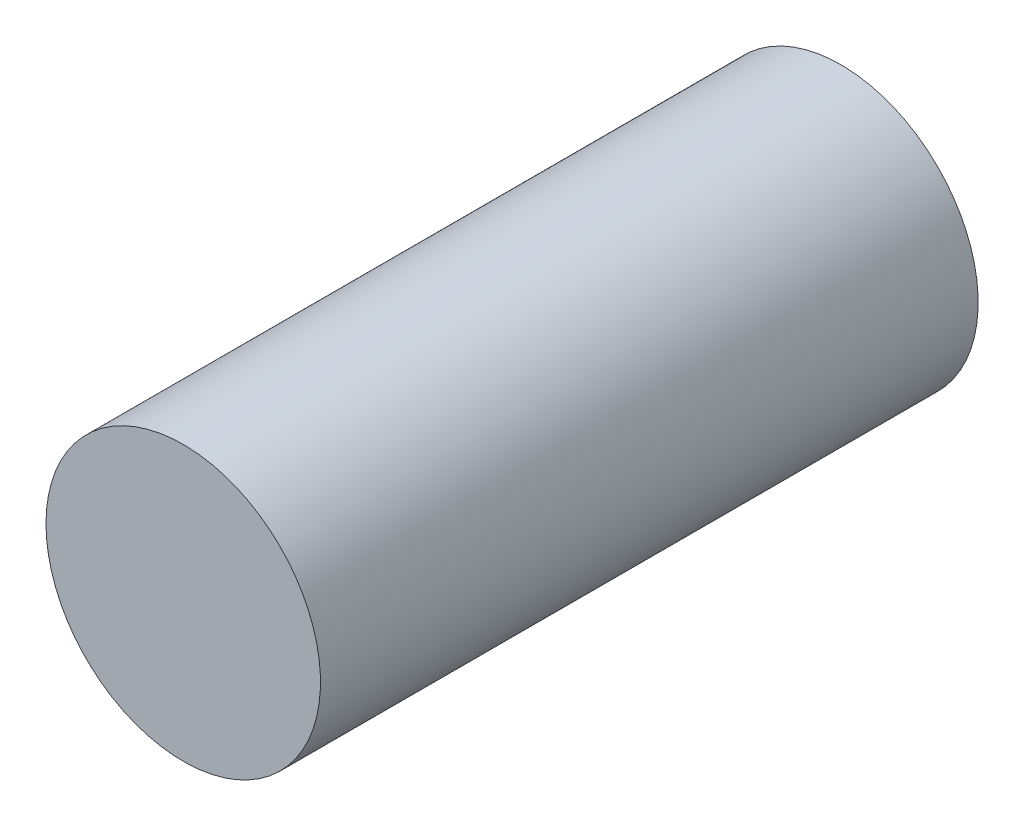
from build123d import *

# Parameters (mm, degrees)
SKETCH1_R      = 31.80207
EXTRUDE1_DEPTH = 76.2


with BuildPart() as part:
    # Sketch1 → Extrude1 (new, symmetric)
    with BuildSketch(Plane.XY):
        Circle(SKETCH1_R)
    extrude(amount=EXTRUDE1_DEPTH, both=True)


solid = part.part
